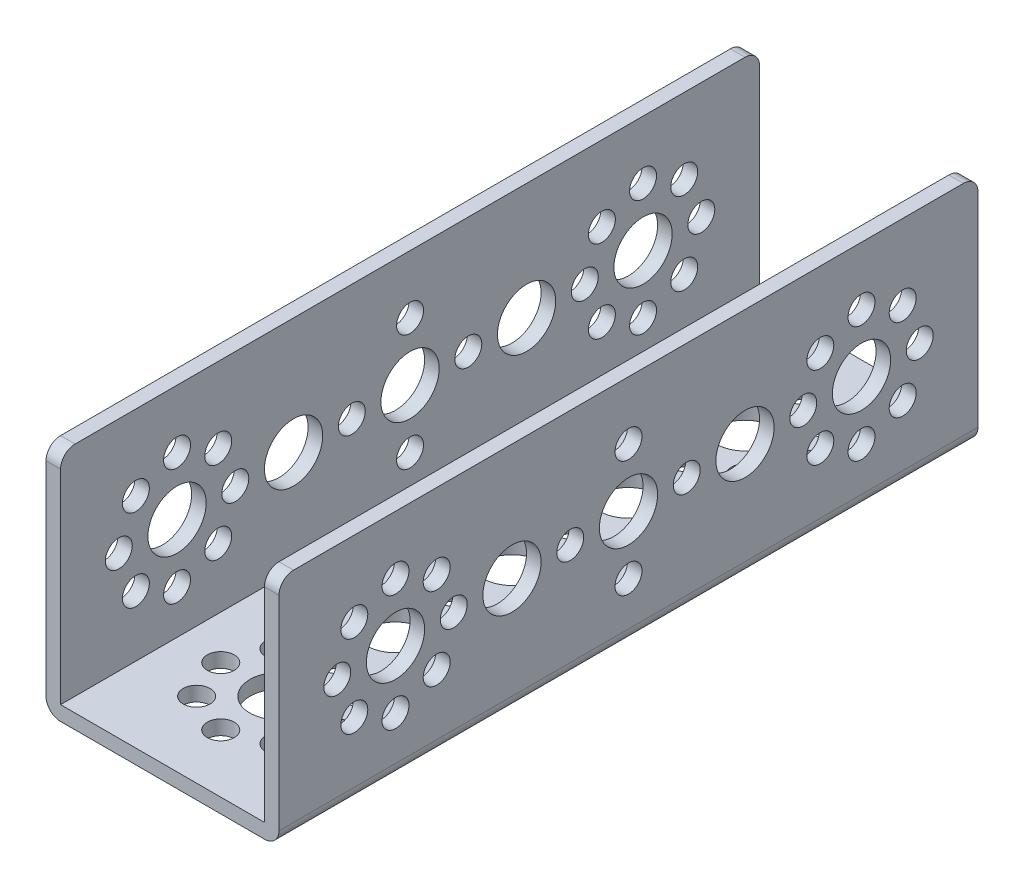
from build123d import *

# Parameters (mm, degrees)
BOSS_EXTRUDE1_DEPTH = 48
SKETCH2_R           = 4
SKETCH2_R_2         = 1.85
CUT_EXTRUDE1_DEPTH  = 32
SKETCH6_R           = 4
SKETCH6_R_2         = 1.85
CUT_EXTRUDE2_DEPTH  = 2
FILLET1_R           = 2


with BuildPart() as part:
    # Sketch1 → Boss-Extrude1 (new, symmetric)
    with BuildSketch(Plane.XY):
        with BuildLine():
            Line((-14, 0), (14, 0))
            ThreePointArc((14, 0), (15.414213562, 0.585786438), (16, 2))
            Line((16, 2), (16, 32))
            Line((16, 32), (14, 32))
            Line((14, 32), (14, 2))
            Line((14, 2), (-14, 2))
            Line((-14, 2), (-14, 32))
            Line((-14, 32), (-16, 32))
            Line((-16, 32), (-16, 2))
            ThreePointArc((-16, 2), (-15.414213562, 0.585786438), (-14, 0))
        make_face()
    extrude(amount=BOSS_EXTRUDE1_DEPTH, both=True)

    # Sketch2 → Cut-Extrude1 (cut)
    with BuildSketch(Plane(origin=(16, 0, 0), x_dir=(0, 0, -1), z_dir=(1, 0, 0))):
        with Locations((0, 16)):
            Circle(SKETCH2_R)
        with Locations((8, 16)):
            Circle(SKETCH2_R_2)
        with Locations((-8, 16)):
            Circle(SKETCH2_R_2)
        with Locations((0, 8)):
            Circle(SKETCH2_R_2)
        with Locations((0, 24)):
            Circle(SKETCH2_R_2)
        with Locations((-16, 16)):
            Circle(SKETCH2_R)
        with Locations((16, 16)):
            Circle(SKETCH2_R)
        with Locations((40, 16)):
            Circle(SKETCH2_R_2)
        with Locations((32, 8)):
            Circle(SKETCH2_R_2)
        with Locations((32, 16)):
            Circle(SKETCH2_R)
        with Locations((32, 24)):
            Circle(SKETCH2_R_2)
        with Locations((26.343145751, 21.656854249)):
            Circle(SKETCH2_R_2)
        with Locations((26.343145751, 10.343145751)):
            Circle(SKETCH2_R_2)
        with Locations((24, 16)):
            Circle(SKETCH2_R_2)
        with Locations((37.656854249, 21.656854249)):
            Circle(SKETCH2_R_2)
        with Locations((37.656854249, 10.343145751)):
            Circle(SKETCH2_R_2)
        with Locations((-24, 16)):
            Circle(SKETCH2_R_2)
        with Locations((-32, 8)):
            Circle(SKETCH2_R_2)
        with Locations((-32, 16)):
            Circle(SKETCH2_R)
        with Locations((-32, 24)):
            Circle(SKETCH2_R_2)
        with Locations((-37.656854249, 21.656854249)):
            Circle(SKETCH2_R_2)
        with Locations((-37.656854249, 10.343145751)):
            Circle(SKETCH2_R_2)
        with Locations((-40, 16)):
            Circle(SKETCH2_R_2)
        with Locations((-26.343145751, 21.656854249)):
            Circle(SKETCH2_R_2)
        with Locations((-26.343145751, 10.343145751)):
            Circle(SKETCH2_R_2)
    extrude(amount=-CUT_EXTRUDE1_DEPTH, mode=Mode.SUBTRACT)

    # Sketch6 → Cut-Extrude2 (cut)
    with BuildSketch(Plane(origin=(0, 2, 0), x_dir=(1, 0, 0), z_dir=(0, 1, 0))):
        Circle(SKETCH6_R)
        with Locations((0, 8)):
            Circle(SKETCH6_R_2)
        with Locations((0, -8)):
            Circle(SKETCH6_R_2)
        with Locations((8, 0)):
            Circle(SKETCH6_R_2)
        with Locations((-8, 0)):
            Circle(SKETCH6_R_2)
        with Locations((0, -16)):
            Circle(SKETCH6_R)
        with Locations((0, 16)):
            Circle(SKETCH6_R)
        with Locations((0, 24)):
            Circle(SKETCH6_R_2)
        with Locations((-8, 32)):
            Circle(SKETCH6_R_2)
        with Locations((0, 32)):
            Circle(SKETCH6_R)
        with Locations((8, 32)):
            Circle(SKETCH6_R_2)
        with Locations((5.656854249, 37.656854249)):
            Circle(SKETCH6_R_2)
        with Locations((-5.656854249, 37.656854249)):
            Circle(SKETCH6_R_2)
        with Locations((0, 40)):
            Circle(SKETCH6_R_2)
        with Locations((5.656854249, 26.343145751)):
            Circle(SKETCH6_R_2)
        with Locations((-5.656854249, 26.343145751)):
            Circle(SKETCH6_R_2)
        with Locations((0, -40)):
            Circle(SKETCH6_R_2)
        with Locations((-8, -32)):
            Circle(SKETCH6_R_2)
        with Locations((0, -32)):
            Circle(SKETCH6_R)
        with Locations((8, -32)):
            Circle(SKETCH6_R_2)
        with Locations((5.656854249, -26.343145751)):
            Circle(SKETCH6_R_2)
        with Locations((-5.656854249, -26.343145751)):
            Circle(SKETCH6_R_2)
        with Locations((0, -24)):
            Circle(SKETCH6_R_2)
        with Locations((5.656854249, -37.656854249)):
            Circle(SKETCH6_R_2)
        with Locations((-5.656854249, -37.656854249)):
            Circle(SKETCH6_R_2)
    extrude(amount=-CUT_EXTRUDE2_DEPTH, mode=Mode.SUBTRACT)

    # Fillet1
    fillet1_edges = [part.edges().sort_by_distance(p)[0] for p in [
        (-15, 32, 48),
        (-15, 32, -48),
        (15, 32, -48),
        (15, 32, 48),
    ]]
    fillet(fillet1_edges, radius=FILLET1_R)


solid = part.part
